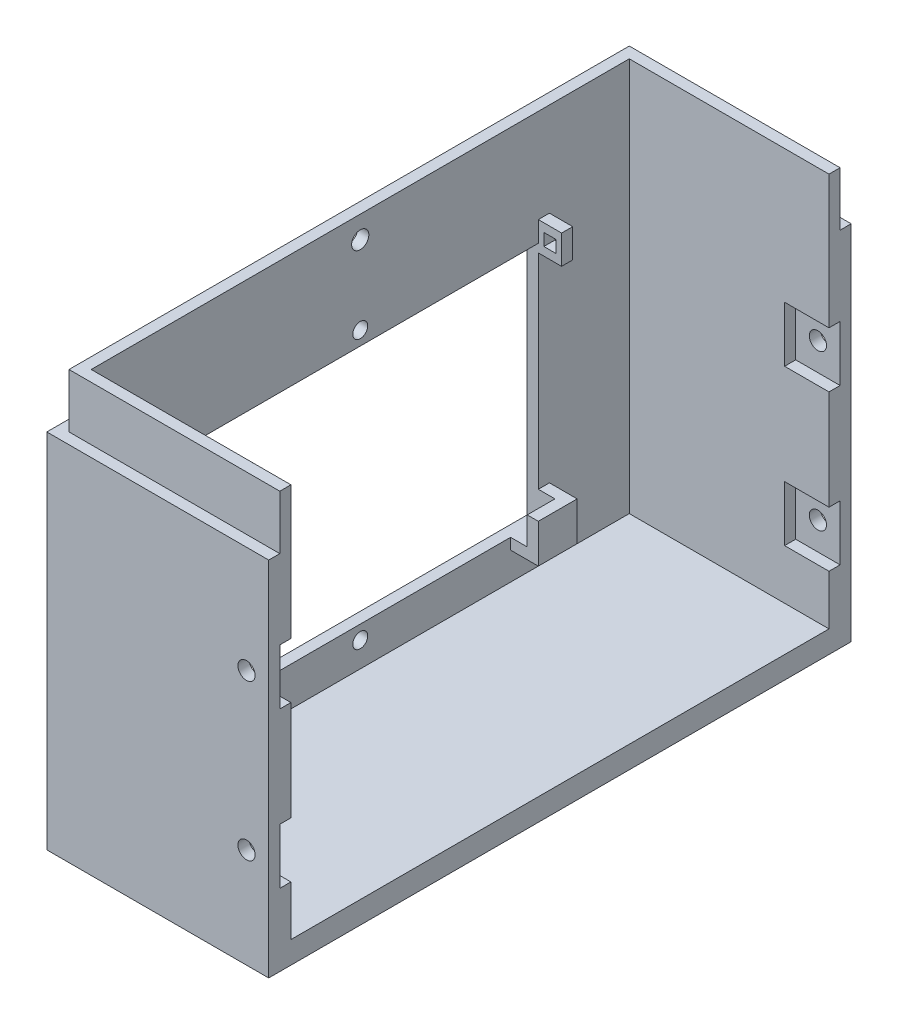
from build123d import *

# Parameters (mm, degrees)
COMBINE1_START         = -8.34304364
COMBINE1_DEPTH         = 32
COMBINE1_START_2       = -6.34304364
COMBINE1_2_OUTLINE_R   = 1.35
COMBINE1_2_OUTLINE_W   = 43.4
COMBINE1_2_OUTLINE_H   = 64.2
COMBINE1_2_OUTLINE_R_2 = 1.55
COMBINE1_2_DEPTH       = 2
COMBINE1_3_OUTLINE_W   = 61.2
COMBINE1_3_OUTLINE_H   = 97
COMBINE1_3_OUTLINE_W_2 = 53.4
COMBINE1_3_OUTLINE_H_2 = 74.2
COMBINE1_3_DEPTH       = 2
COMBINE1_START_3       = -4.34304364
COMBINE1_4_DEPTH       = 30.4499999
COMBINE1_START_4       = 29.20695646
COMBINE1_5_DEPTH       = 2.4499999
COMBINE1_START_5       = 23.65695636
COMBINE1_6_OUTLINE_W   = 9.8
COMBINE1_6_OUTLINE_H   = 2
COMBINE1_6_DEPTH       = 8
COMBINE1_START_6       = 42.835743365
COMBINE1_7_OUTLINE_W   = 3.1000002
COMBINE1_7_OUTLINE_H   = 4
COMBINE1_7_DEPTH       = 105
COMBINE1_8_OUTLINE_W   = 3.1000002
COMBINE1_8_OUTLINE_H   = 18
COMBINE1_8_OUTLINE_H_2 = 14.2
COMBINE1_8_OUTLINE_H_3 = 9
COMBINE1_8_DEPTH       = 4
COMBINE1_START_7       = 143.835743365
COMBINE1_9_OUTLINE_W   = 3.1000002
COMBINE1_9_OUTLINE_H   = 18
COMBINE1_9_OUTLINE_H_2 = 14.2
COMBINE1_9_OUTLINE_H_3 = 9
COMBINE1_9_DEPTH       = 4
COMBINE1_10_DEPTH      = 2
COMBINE1_START_8       = 145.835743365
COMBINE1_11_DEPTH      = 2
CUT_EXTRUDE1_REACH     = 179.801
SKETCH2_R              = 1.5
BOSS_EXTRUDE1_DEPTH    = 3
SKETCH4_W              = 7
SKETCH4_H              = 7
BOSS_EXTRUDE2_DEPTH    = 2
SKETCH5_W              = 2
SKETCH5_H              = 5.2
BOSS_EXTRUDE3_DEPTH    = 4.2
CUT_EXTRUDE2_REACH     = 130.923
SKETCH6_W              = 2.2
SKETCH6_H              = 2.2
CUT_EXTRUDE3_REACH     = 130.923
SKETCH7_W              = 2.2
SKETCH7_H              = 2.2
SKETCH8_W              = 2
SKETCH8_H              = 101
BOSS_EXTRUDE4_DEPTH    = 0.05


with BuildPart() as part:
    # Combine1: read off the stored shape, not the designer's step
    # Combine1 outline → Combine1 (new body)
    with BuildSketch(Plane.YZ.offset(COMBINE1_START)):
        Polygon((82.18784428, 42.835743365), (82.18784428, 46.835743365), (20.98784428, 46.835743365), (20.98784428, 143.835743365), (82.18784428, 143.835743365), (82.18784428, 147.835743365), (16.98784428, 147.835743365), (16.98784428, 42.835743365), align=None)
    extrude(amount=COMBINE1_DEPTH)

    # Combine1 2 outline → Combine1 2 (add)
    with BuildSketch(Plane.YZ.offset(COMBINE1_START_2)):
        Polygon((82.18784428, 46.835743365), (82.18784428, 44.835743365), (91.98784428, 44.835743365), (91.98784428, 145.835743365), (82.18784428, 145.835743365), (82.18784428, 143.835743365), (20.98784428, 143.835743365), (20.98784428, 46.835743365), align=None)
        with Locations((25.48784428, 95.335743365)):
            Circle(COMBINE1_2_OUTLINE_R, mode=Mode.SUBTRACT)
        with Locations((49.68784428, 95.335743365)):
            Rectangle(COMBINE1_2_OUTLINE_W, COMBINE1_2_OUTLINE_H, mode=Mode.SUBTRACT)
        with Locations((73.88784428, 95.335743365)):
            Circle(COMBINE1_2_OUTLINE_R, mode=Mode.SUBTRACT)
        with Locations((87.98784428, 95.335743365)):
            Circle(COMBINE1_2_OUTLINE_R_2, mode=Mode.SUBTRACT)
    extrude(amount=COMBINE1_2_DEPTH)

    # Combine1 3 outline → Combine1 3 (add)
    with BuildSketch(Plane.YZ.offset(COMBINE1_START)):
        with Locations((51.58784428, 95.335743365)):
            Rectangle(COMBINE1_3_OUTLINE_W, COMBINE1_3_OUTLINE_H)
        with Locations((49.68784428, 95.335743365)):
            Rectangle(COMBINE1_3_OUTLINE_W_2, COMBINE1_3_OUTLINE_H_2, mode=Mode.SUBTRACT)
    extrude(amount=COMBINE1_3_DEPTH)

    # Combine1 4 outline → Combine1 4 (add)
    with BuildSketch(Plane.YZ.offset(COMBINE1_START_3)):
        Polygon((82.18784428, 44.835743365), (91.98784428, 44.835743365), (91.98784428, 46.835743365), (67.98784428, 46.835743365), (67.98784428, 44.835743365), (57.98784428, 44.835743365), (57.98784428, 46.835743365), (39.98784428, 46.835743365), (39.98784428, 44.835743365), (29.98784428, 44.835743365), (29.98784428, 46.835743365), (20.98784428, 46.835743365), (20.98784428, 143.835743365), (29.98784428, 143.835743365), (29.98784428, 145.835743365), (39.98784428, 145.835743365), (39.98784428, 143.835743365), (57.98784428, 143.835743365), (57.98784428, 145.835743365), (67.98784428, 145.835743365), (67.98784428, 143.835743365), (91.98784428, 143.835743365), (91.98784428, 145.835743365), (82.18784428, 145.835743365), (82.18784428, 147.835743365), (16.98784428, 147.835743365), (16.98784428, 42.835743365), (82.18784428, 42.835743365), align=None)
    extrude(amount=COMBINE1_4_DEPTH)



with BuildPart() as body_2:
    # Combine1 5 outline → Combine1 5 (new body)
    with BuildSketch(Plane.YZ.offset(COMBINE1_START_4)):
        Polygon((82.18784428, 44.835743365), (91.98784428, 44.835743365), (91.98784428, 46.835743365), (67.98784428, 46.835743365), (67.98784428, 44.835743365), (57.98784428, 44.835743365), (57.98784428, 46.835743365), (39.98784428, 46.835743365), (39.98784428, 44.835743365), (29.98784428, 44.835743365), (29.98784428, 46.835743365), (20.98784428, 46.835743365), (20.98784428, 143.835743365), (29.98784428, 143.835743365), (29.98784428, 145.835743365), (39.98784428, 145.835743365), (39.98784428, 143.835743365), (57.98784428, 143.835743365), (57.98784428, 145.835743365), (67.98784428, 145.835743365), (67.98784428, 143.835743365), (91.98784428, 143.835743365), (91.98784428, 145.835743365), (82.18784428, 145.835743365), (82.18784428, 147.835743365), (16.98784428, 147.835743365), (16.98784428, 42.835743365), (82.18784428, 42.835743365), align=None)
    extrude(amount=COMBINE1_5_DEPTH)


with BuildPart() as part_1:
    add(part.part)

    add(body_2.part)  # Combine1 6 merges body 2
    # Combine1 6 outline → Combine1 6 (add)
    with BuildSketch(Plane.YZ.offset(COMBINE1_START_5)):
        with Locations((87.08784428, 45.835743365)):
            Rectangle(COMBINE1_6_OUTLINE_W, COMBINE1_6_OUTLINE_H)
        with Locations((87.08784428, 144.835743365)):
            Rectangle(COMBINE1_6_OUTLINE_W, COMBINE1_6_OUTLINE_H)
    extrude(amount=COMBINE1_6_DEPTH)

    # Combine1 7 outline → Combine1 7 (add)
    with BuildSketch(Plane.XY.offset(COMBINE1_START_6)):
        with Locations((27.65695636, 18.98784428)):
            Rectangle(COMBINE1_7_OUTLINE_W, COMBINE1_7_OUTLINE_H)
    extrude(amount=COMBINE1_7_DEPTH)

    # Combine1 8 outline → Combine1 8 (add)
    with BuildSketch(Plane.XY.offset(COMBINE1_START_6)):
        with Locations((27.65695636, 48.98784428)):
            Rectangle(COMBINE1_8_OUTLINE_W, COMBINE1_8_OUTLINE_H)
        with Locations((27.65695636, 75.08784428)):
            Rectangle(COMBINE1_8_OUTLINE_W, COMBINE1_8_OUTLINE_H_2)
        with Locations((27.65695636, 25.48784428)):
            Rectangle(COMBINE1_8_OUTLINE_W, COMBINE1_8_OUTLINE_H_3)
    extrude(amount=COMBINE1_8_DEPTH)

    # Combine1 9 outline → Combine1 9 (add)
    with BuildSketch(Plane.XY.offset(COMBINE1_START_7)):
        with Locations((27.65695636, 48.98784428)):
            Rectangle(COMBINE1_9_OUTLINE_W, COMBINE1_9_OUTLINE_H)
        with Locations((27.65695636, 75.08784428)):
            Rectangle(COMBINE1_9_OUTLINE_W, COMBINE1_9_OUTLINE_H_2)
        with Locations((27.65695636, 25.48784428)):
            Rectangle(COMBINE1_9_OUTLINE_W, COMBINE1_9_OUTLINE_H_3)
    extrude(amount=COMBINE1_9_DEPTH)

    # Combine1 10 outline → Combine1 10 (add)
    with BuildSketch(Plane.XY.offset(COMBINE1_START_6)):
        with BuildLine():
            Line((29.20695646, 57.98784428), (29.20695636, 62.98784428))
            ThreePointArc((29.20695636, 62.98784428), (27.656956333, 61.43784428), (26.10695636, 62.987844335))
            Line((26.10695636, 62.987844335), (26.10695626, 57.98784428))
            Line((26.10695626, 57.98784428), (29.20695646, 57.98784428))
        make_face()
        with BuildLine():
            ThreePointArc((26.10695636, 62.987844335), (27.656956387, 64.53784428), (29.20695636, 62.98784428))
            Line((29.20695636, 62.98784428), (29.20695646, 67.98784428))
            Line((29.20695646, 67.98784428), (26.10695626, 67.98784428))
            Line((26.10695626, 67.98784428), (26.10695636, 62.987844335))
        make_face()
        with BuildLine():
            Line((29.20695636, 34.98784428), (29.20695646, 39.98784428))
            Line((29.20695646, 39.98784428), (26.10695626, 39.98784428))
            Line((26.10695626, 39.98784428), (26.10695636, 34.98784428))
            ThreePointArc((26.10695636, 34.98784428), (27.65695636, 36.53784428), (29.20695636, 34.98784428))
        make_face()
        with BuildLine():
            Line((29.20695646, 29.98784428), (29.20695636, 34.98784428))
            ThreePointArc((29.20695636, 34.98784428), (27.65695636, 33.43784428), (26.10695636, 34.98784428))
            Line((26.10695636, 34.98784428), (26.10695626, 29.98784428))
            Line((26.10695626, 29.98784428), (29.20695646, 29.98784428))
        make_face()
    extrude(amount=COMBINE1_10_DEPTH)

    # Combine1 11 outline → Combine1 11 (add)
    with BuildSketch(Plane.XY.offset(COMBINE1_START_8)):
        with BuildLine():
            Line((29.20695646, 57.98784428), (29.20695636, 62.98784428))
            ThreePointArc((29.20695636, 62.98784428), (27.656956333, 61.43784428), (26.10695636, 62.987844335))
            Line((26.10695636, 62.987844335), (26.10695626, 57.98784428))
            Line((26.10695626, 57.98784428), (29.20695646, 57.98784428))
        make_face()
        with BuildLine():
            ThreePointArc((26.10695636, 62.987844335), (27.656956387, 64.53784428), (29.20695636, 62.98784428))
            Line((29.20695636, 62.98784428), (29.20695646, 67.98784428))
            Line((29.20695646, 67.98784428), (26.10695626, 67.98784428))
            Line((26.10695626, 67.98784428), (26.10695636, 62.987844335))
        make_face()
        with BuildLine():
            Line((29.20695636, 34.98784428), (29.20695646, 39.98784428))
            Line((29.20695646, 39.98784428), (26.10695626, 39.98784428))
            Line((26.10695626, 39.98784428), (26.10695636, 34.98784428))
            ThreePointArc((26.10695636, 34.98784428), (27.65695636, 36.53784428), (29.20695636, 34.98784428))
        make_face()
        with BuildLine():
            Line((29.20695646, 29.98784428), (29.20695636, 34.98784428))
            ThreePointArc((29.20695636, 34.98784428), (27.65695636, 33.43784428), (26.10695636, 34.98784428))
            Line((26.10695636, 34.98784428), (26.10695626, 29.98784428))
            Line((26.10695626, 29.98784428), (29.20695646, 29.98784428))
        make_face()
    extrude(amount=COMBINE1_11_DEPTH)

    # Sketch2 → Cut-Extrude1 (cut, up to next)
    with BuildSketch(Plane(origin=(-4.34304364, 0, 0), x_dir=(0, 0, -1), z_dir=(1, 0, 0)), mode=Mode.PRIVATE) as cut_extrude1_sk1:
        with Locations(Location((-129.935743365, 49.68784428, 0), (0, 0, 90))):
            Circle(SKETCH2_R)
    cut_extrude1_tool1 = extrude(cut_extrude1_sk1.sketch, amount=-CUT_EXTRUDE1_REACH, mode=Mode.PRIVATE) & part_1.part
    add(cut_extrude1_tool1.solids().sort_by_distance((-4.343044, 49.687844, 129.935743))[0], mode=Mode.SUBTRACT)

    # Sketch3 → Boss-Extrude1 (add)
    with BuildSketch(Plane(origin=(-4.34304364, 0, 0), x_dir=(0, 0, -1), z_dir=(1, 0, 0))):
        Polygon((-127.435743365, 27.98784428), (-127.435743365, 32.98784428), (-129.435743365, 32.98784428), (-129.435743365, 27.98784428), (-129.435743365, 25.98784428), (-122.435743365, 25.98784428), (-122.435743365, 27.98784428), align=None)
        Polygon((-63.235743365, 27.98784428), (-68.235743365, 27.98784428), (-68.235743365, 25.98784428), (-61.235743365, 25.98784428), (-61.235743365, 27.98784428), (-61.235743365, 32.98784428), (-63.235743365, 32.98784428), align=None)
    extrude(amount=BOSS_EXTRUDE1_DEPTH)

    # Sketch4 → Boss-Extrude2 (add)
    with BuildSketch(Plane(origin=(-1.34304364, 0, 0), x_dir=(0, 0, -1), z_dir=(1, 0, 0))):
        with Locations((-125.935743365, 29.48784428)):
            Rectangle(SKETCH4_W, SKETCH4_H)
        with Locations((-64.735743365, 29.48784428)):
            Rectangle(SKETCH4_W, SKETCH4_H)
    extrude(amount=BOSS_EXTRUDE2_DEPTH)

    # Sketch5 → Boss-Extrude3 (add)
    with BuildSketch(Plane(origin=(-4.34304364, 0, 0), x_dir=(0, 0, -1), z_dir=(1, 0, 0))):
        with Locations((-128.435743365, 72.48784428)):
            Rectangle(SKETCH5_W, SKETCH5_H)
        with Locations((-62.235743365, 72.48784428)):
            Rectangle(SKETCH5_W, SKETCH5_H)
    extrude(amount=BOSS_EXTRUDE3_DEPTH)

    # Sketch6 → Cut-Extrude2 (cut, up to next)
    with BuildSketch(Plane.XY.offset(63.235743365), mode=Mode.PRIVATE) as cut_extrude2_sk1:
        with Locations((-2.24304364, 72.48784428)):
            Rectangle(SKETCH6_W, SKETCH6_H)
    cut_extrude2_tool1 = extrude(cut_extrude2_sk1.sketch, amount=-CUT_EXTRUDE2_REACH, mode=Mode.PRIVATE) & part_1.part
    add(cut_extrude2_tool1.solids().sort_by_distance((-2.243044, 72.487844, 63.235743))[0], mode=Mode.SUBTRACT)

    # Sketch7 → Cut-Extrude3 (cut, up to next)
    with BuildSketch(Plane(origin=(0, 0, 127.435743365), x_dir=(-1, 0, 0), z_dir=(0, 0, -1)), mode=Mode.PRIVATE) as cut_extrude3_sk1:
        with Locations((2.24304364, 72.48784428)):
            Rectangle(SKETCH7_W, SKETCH7_H)
    cut_extrude3_tool1 = extrude(cut_extrude3_sk1.sketch, amount=-CUT_EXTRUDE3_REACH, mode=Mode.PRIVATE) & part_1.part
    add(cut_extrude3_tool1.solids().sort_by_distance((-2.243044, 72.487844, 127.435743))[0], mode=Mode.SUBTRACT)

    # Sketch8 → Boss-Extrude4 (add)
    with BuildSketch(Plane(origin=(0, 82.18784428, 0), x_dir=(1, 0, 0), z_dir=(0, 1, 0))):
        Polygon((31.65695636, -42.835743365), (-8.34304364, -42.835743365), (-8.34304364, -44.835743365), (-6.34304364, -44.835743365), (31.65695636, -44.835743365), align=None)
        with Locations((-7.34304364, -95.335743365)):
            Rectangle(SKETCH8_W, SKETCH8_H)
        Polygon((-6.34304364, -145.835743365), (-8.34304364, -145.835743365), (-8.34304364, -147.835743365), (31.65695636, -147.835743365), (31.65695636, -145.835743365), align=None)
    extrude(amount=BOSS_EXTRUDE4_DEPTH)


solid = part_1.part
